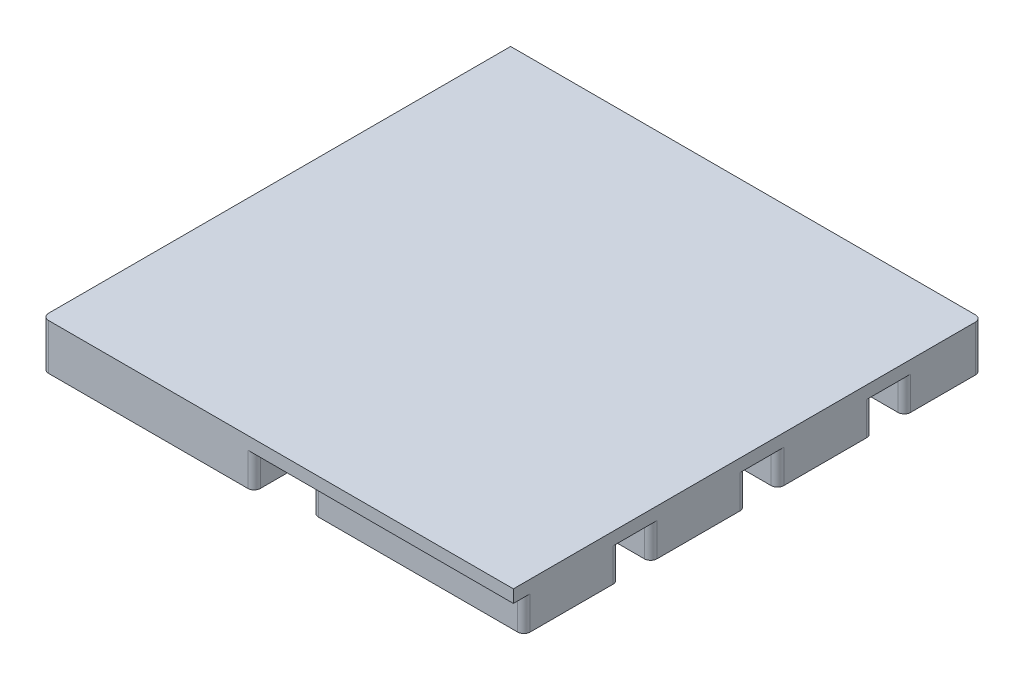
from build123d import *

# Parameters (mm, degrees)
SKETCH2_W           = 149
SKETCH2_H           = 148.13
BOSS_EXTRUDE1_DEPTH = 4
SKETCH3_W           = 67
SKETCH3_H           = 24.5
SKETCH3_H_2         = 30.2
SKETCH3_H_3         = 30.1967
BOSS_EXTRUDE3_DEPTH = 14.5
FILLET1_R           = 2


with BuildPart() as part:
    # Sketch2 → Boss-Extrude1 (new body)
    with BuildSketch(Plane(origin=(0, 0, 0), x_dir=(1, 0, 0), z_dir=(0, 1, 0))):
        with Locations((74.5, 74.065)):
            Rectangle(SKETCH2_W, SKETCH2_H)
    extrude(amount=BOSS_EXTRUDE1_DEPTH)

    # Sketch3 → Boss-Extrude3 (add)
    # profile 1 of 8: a face of its own
    with BuildSketch(Plane(origin=(0, 4, 0), x_dir=(1, 0, 0), z_dir=(0, 1, 0))):
        with Locations((115.5, 135.88)):
            Rectangle(SKETCH3_W, SKETCH3_H)
        with BuildLine():
            ThreePointArc((97.3, 135.98), (94.975, 138.305), (97.3, 140.63))
            Line((97.3, 140.63), (124.6, 140.63))
            ThreePointArc((124.6, 140.63), (126.925, 138.305), (124.6, 135.98))
            Line((124.6, 135.98), (97.3, 135.98))
        make_face(mode=Mode.SUBTRACT)
    # profile 2 of 8: a face of its own
    with BuildSketch(Plane(origin=(0, 4, 0), x_dir=(1, 0, 0), z_dir=(0, 1, 0))):
        with Locations((115.5, 98.63)):
            Rectangle(SKETCH3_W, SKETCH3_H_2)
        with BuildLine():
            ThreePointArc((97.3, 95.33), (95, 97.63), (97.3, 99.93))
            Line((97.3, 99.93), (124.6, 99.93))
            ThreePointArc((124.6, 99.93), (126.9, 97.63), (124.6, 95.33))
            Line((124.6, 95.33), (97.3, 95.33))
        make_face(mode=Mode.SUBTRACT)
    # profile 3 of 8: a face of its own
    with BuildSketch(Plane(origin=(0, 4, 0), x_dir=(1, 0, 0), z_dir=(0, 1, 0))):
        with Locations((33.5, 132.5467)):
            Rectangle(SKETCH3_W, SKETCH3_H)
        with BuildLine():
            ThreePointArc((12.85, 133.2967), (10.525, 135.6217), (12.85, 137.9467))
            Line((12.85, 137.9467), (40.15, 137.9467))
            ThreePointArc((40.15, 137.9467), (42.475, 135.6217), (40.15, 133.2967))
            Line((40.15, 133.2967), (12.85, 133.2967))
        make_face(mode=Mode.SUBTRACT)
    # profile 4 of 8: a face of its own
    with BuildSketch(Plane(origin=(0, 4, 0), x_dir=(1, 0, 0), z_dir=(0, 1, 0))):
        with Locations((115.5, 58.53)):
            Rectangle(SKETCH3_W, SKETCH3_H_2)
        with BuildLine():
            ThreePointArc((97.3, 55.23), (95, 57.53), (97.3, 59.83))
            Line((97.3, 59.83), (124.6, 59.83))
            ThreePointArc((124.6, 59.83), (126.9, 57.53), (124.6, 55.23))
            Line((124.6, 55.23), (97.3, 55.23))
        make_face(mode=Mode.SUBTRACT)
    # profile 5 of 8: a face of its own
    with BuildSketch(Plane(origin=(0, 4, 0), x_dir=(1, 0, 0), z_dir=(0, 1, 0))):
        with Locations((33.5, 95.2967)):
            Rectangle(SKETCH3_W, SKETCH3_H_2)
        with BuildLine():
            ThreePointArc((12.85, 91.9967), (10.55, 94.2967), (12.85, 96.5967))
            Line((12.85, 96.5967), (40.15, 96.5967))
            ThreePointArc((40.15, 96.5967), (42.45, 94.2967), (40.15, 91.9967))
            Line((40.15, 91.9967), (12.85, 91.9967))
        make_face(mode=Mode.SUBTRACT)
    # profile 6 of 8: a face of its own
    with BuildSketch(Plane(origin=(0, 4, 0), x_dir=(1, 0, 0), z_dir=(0, 1, 0))):
        with Locations((115.5, 18.43)):
            Rectangle(SKETCH3_W, SKETCH3_H_2)
        with BuildLine():
            ThreePointArc((97.3, 15.13), (95, 17.43), (97.3, 19.73))
            Line((97.3, 19.73), (124.6, 19.73))
            ThreePointArc((124.6, 19.73), (126.9, 17.43), (124.6, 15.13))
            Line((124.6, 15.13), (97.3, 15.13))
        make_face(mode=Mode.SUBTRACT)
    # profile 7 of 8: a face of its own
    with BuildSketch(Plane(origin=(0, 4, 0), x_dir=(1, 0, 0), z_dir=(0, 1, 0))):
        with Locations((33.5, 55.1967)):
            Rectangle(SKETCH3_W, SKETCH3_H_2)
        with BuildLine():
            ThreePointArc((12.85, 51.8967), (10.55, 54.1967), (12.85, 56.4967))
            Line((12.85, 56.4967), (40.15, 56.4967))
            ThreePointArc((40.15, 56.4967), (42.45, 54.1967), (40.15, 51.8967))
            Line((40.15, 51.8967), (12.85, 51.8967))
        make_face(mode=Mode.SUBTRACT)
    # profile 8 of 8: a face of its own
    with BuildSketch(Plane(origin=(0, 4, 0), x_dir=(1, 0, 0), z_dir=(0, 1, 0))):
        with Locations((33.5, 15.09835)):
            Rectangle(SKETCH3_W, SKETCH3_H_3)
        with BuildLine():
            ThreePointArc((12.85, 11.7967), (10.55, 14.0967), (12.85, 16.3967))
            Line((12.85, 16.3967), (40.15, 16.3967))
            ThreePointArc((40.15, 16.3967), (42.45, 14.0967), (40.15, 11.7967))
            Line((40.15, 11.7967), (12.85, 11.7967))
        make_face(mode=Mode.SUBTRACT)
    extrude(amount=-BOSS_EXTRUDE3_DEPTH)

    # Fillet1
    fillet1_edges = [part.edges().sort_by_distance(p)[0] for p in [
        (149, -5.25, -3.33),
        (149, -5.25, -33.53),
        (82, -5.25, -33.53),
        (82, -5.25, -3.33),
        (67, -5.25, 0),
        (0, -3.25, 0),
        (0, -5.25, -30.1967),
        (67, -5.25, -30.1967),
        (67, -5.25, -40.0967),
        (0, -5.25, -40.0967),
        (149, -5.25, -43.43),
        (82, -5.25, -43.43),
        (82, -5.25, -73.63),
        (67, -5.25, -70.2967),
        (0, -5.25, -70.2967),
        (0, -5.25, -80.1967),
        (82, -5.25, -83.53),
        (67, -5.25, -80.1967),
        (0, -5.25, -110.3967),
        (149, -5.25, -83.53),
        (149, -5.25, -73.63),
        (149, -5.25, -113.73),
        (67, -5.25, -110.3967),
        (82, -5.25, -113.73),
        (0, -5.25, -120.2967),
        (67, -5.25, -120.2967),
        (67, -5.25, -144.7967),
        (0, -5.25, -144.7967),
        (82, -5.25, -123.63),
        (149, -5.25, -123.63),
        (149, -3.25, -148.13),
        (82, -5.25, -148.13),
    ]]
    fillet(fillet1_edges, radius=FILLET1_R)


solid = part.part
